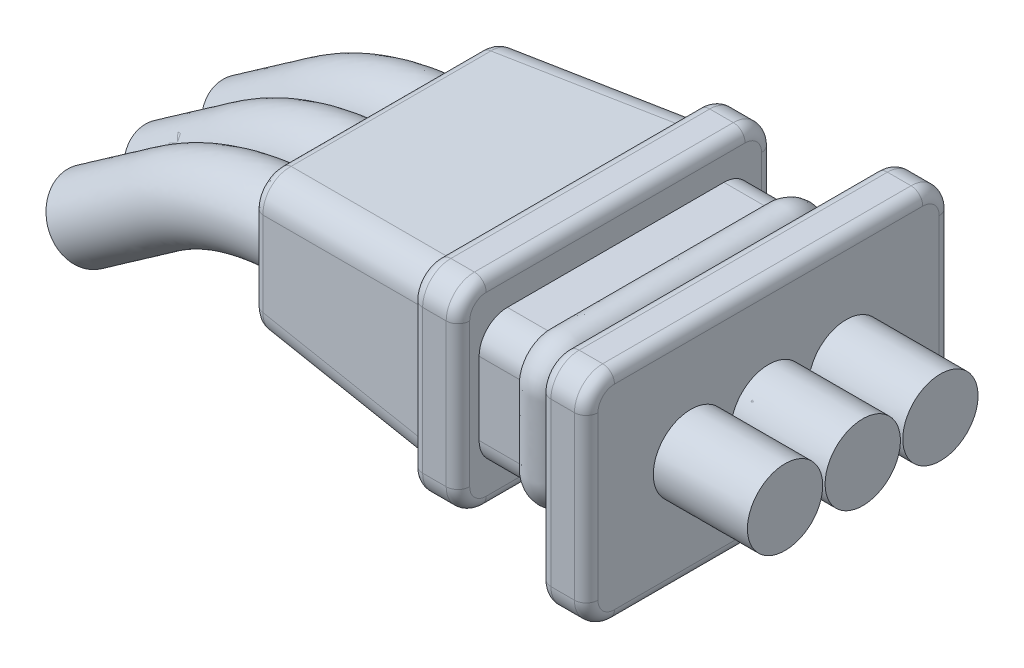
from build123d import *

# Parameters (mm, degrees)
SKETCH1_W            = 7.75
SKETCH1_H            = 4.65
BOSS_EXTRUDE1_DEPTH  = 1
SKETCH2_W            = 5.8
SKETCH2_H            = 2.75
BOSS_EXTRUDE2_DEPTH  = 2.25
SKETCH3_W            = 6.7
SKETCH3_H            = 4.25
BOSS_EXTRUDE3_DEPTH  = 1
SKETCH4_W            = 6.1
SKETCH4_H            = 3.65
BOSS_EXTRUDE4_DEPTH  = 4
BOSS_EXTRUDE4_TAPER  = 5
FILLET1_R            = 0.6
FILLET2_R            = 0.25
CUT_EXTRUDE6_DEPTH   = 10.406580185
SWEEP3_PROFILE_R     = 0.8
LPATTERN1_COUNT      = 2
LPATTERN1_PITCH      = 1.65
LPATTERN1_COUNT_DIR2 = 2
LPATTERN1_PITCH_DIR2 = 1.65


with BuildPart() as part:
    # Sketch1 → Boss-Extrude1 (new body)
    with BuildSketch(Plane(origin=(0, 0, 0), x_dir=(0, 0, -1), z_dir=(1, 0, 0))):
        Rectangle(SKETCH1_W, SKETCH1_H)
    extrude(amount=BOSS_EXTRUDE1_DEPTH)

    # Sketch2 → Boss-Extrude2 (add)
    with BuildSketch(Plane.ZY):
        Rectangle(SKETCH2_W, SKETCH2_H)
    extrude(amount=BOSS_EXTRUDE2_DEPTH)

    # Sketch3 → Boss-Extrude3 (add)
    with BuildSketch(Plane.ZY.offset(2.25)):
        Rectangle(SKETCH3_W, SKETCH3_H)
    extrude(amount=BOSS_EXTRUDE3_DEPTH)

    # Sketch4 → Boss-Extrude4 (add)
    with BuildSketch(Plane.ZY.offset(3.25)):
        Rectangle(SKETCH4_W, SKETCH4_H)
    extrude(amount=BOSS_EXTRUDE4_DEPTH, taper=BOSS_EXTRUDE4_TAPER)

    # Fillet1
    fillet1_edges = [part.edges().sort_by_distance(p)[0] for p in [
        (-1.125, -1.375, -2.9),
        (-1.125, 1.375, -2.9),
        (-1.125, -1.375, 2.9),
        (0.5, 2.325, -3.875),
        (0.5, -2.325, -3.875),
        (0.5, -2.325, 3.875),
        (-2.75, 2.125, -3.35),
        (-2.75, -2.125, -3.35),
        (-5.25, -1.650022673, -2.875022673),
        (-5.25, -1.650022673, 2.875022673),
        (-5.25, 1.650022673, -2.875022673),
        (-2.75, -2.125, 3.35),
        (0.5, 2.325, 3.875),
        (-1.125, 1.375, 2.9),
        (-5.25, 1.650022673, 2.875022673),
        (-2.75, 2.125, 3.35),
    ]]
    fillet(fillet1_edges, radius=FILLET1_R)

    # Sweep2: sweep along a path in Sketch7
    with BuildLine(Plane.ZY) as sweep2_path:
        Line((-2.3, -1.375), (2.3, -1.375))
        ThreePointArc((2.3, -1.375), (2.724264069, -1.199264069), (2.9, -0.775))
        Line((2.9, -0.775), (2.9, 0.775))
        ThreePointArc((2.9, 0.775), (2.724264069, 1.199264069), (2.3, 1.375))
        Line((2.3, 1.375), (-2.3, 1.375))
        ThreePointArc((-2.3, 1.375), (-2.724264069, 1.199264069), (-2.9, 0.775))
        Line((-2.9, 0.775), (-2.9, -0.775))
        ThreePointArc((-2.9, -0.775), (-2.724264069, -1.199264069), (-2.3, -1.375))
    # Sketch5 → Sweep2 (sweep)
    with BuildSketch(Plane(origin=(0, 0, 0), x_dir=(1, 0, 0), z_dir=(0, 1, 0))):
        with BuildLine():
            Line((-0.625, 2.9), (-1.375, 2.9))
            ThreePointArc((-1.375, 2.9), (-1, 3.116506351), (-0.625, 2.9))
        make_face()
    sweep(path=sweep2_path.line)

    # Fillet2
    fillet2_edges = [part.edges().sort_by_distance(p)[0] for p in [
        (1, -2.149264069, 3.699264069),
        (1, 0, 3.875),
        (1, 2.149264069, 3.699264069),
        (1, 2.325, 0),
        (1, 2.149264069, -3.699264069),
        (1, 0, -3.875),
        (1, -2.149264069, -3.699264069),
        (0, -2.149264069, 3.699264069),
        (0, 0, 3.875),
        (0, 2.149264069, 3.699264069),
        (0, 2.325, 0),
        (0, 2.149264069, -3.699264069),
        (0, 0, -3.875),
        (0, -2.149264069, -3.699264069),
        (1, -2.325, 0),
        (0, -2.325, 0),
        (-7.25, -1.300252666, -2.52525255),
        (-7.25, 0, -2.700045346),
        (-7.25, 1.30025255, -2.525252666),
        (-7.25, 1.475045346, 0),
        (-7.25, 1.300252666, 2.52525255),
        (-7.25, 0, 2.700045346),
        (-7.25, -1.300252666, 2.52525255),
        (-3.25, -1.949264069, -3.174264069),
        (-3.25, 0, -3.35),
        (-3.25, 1.949264069, -3.174264069),
        (-3.25, 2.125, 0),
        (-3.25, 1.949264069, 3.174264069),
        (-3.25, 0, 3.35),
        (-3.25, -1.949264069, 3.174264069),
        (-2.25, -1.949264069, -3.174264069),
        (-2.25, 0, -3.35),
        (-2.25, 1.949264069, -3.174264069),
        (-2.25, 2.125, 0),
        (-2.25, 1.949264069, 3.174264069),
        (-2.25, 0, 3.35),
        (-2.25, -1.949264069, 3.174264069),
        (-7.25, -1.475045346, 0),
        (-3.25, -2.125, 0),
        (-2.25, -2.125, 0),
    ]]
    fillet(fillet2_edges, radius=FILLET2_R)

    # Sketch15 → Cut-Extrude6 (cut, through all)
    with BuildSketch(Plane.ZY.offset(7.25)):
        with BuildLine():
            Line((-0.854701314, 0.25), (-0.795298686, 0.25))
            ThreePointArc((-0.795298686, 0.25), (-0.766858863, 0.258876084), (-0.74851641, 0.282352941))
            ThreePointArc((-0.74851641, 0.282352941), (0, 0.8), (0.74851641, 0.282352941))
            ThreePointArc((0.74851641, 0.282352941), (0.766858863, 0.258876084), (0.795298686, 0.25))
            Line((0.795298686, 0.25), (0.854701314, 0.25))
            ThreePointArc((0.854701314, 0.25), (0.883141137, 0.258876084), (0.90148359, 0.282352941))
            ThreePointArc((0.90148359, 0.282352941), (2.45, 0), (0.90148359, -0.282352941))
            ThreePointArc((0.90148359, -0.282352941), (0.883141137, -0.258876084), (0.854701314, -0.25))
            Line((0.854701314, -0.25), (0.795298686, -0.25))
            ThreePointArc((0.795298686, -0.25), (0.766858863, -0.258876084), (0.74851641, -0.282352941))
            ThreePointArc((0.74851641, -0.282352941), (0, -0.8), (-0.74851641, -0.282352941))
            ThreePointArc((-0.74851641, -0.282352941), (-0.766858863, -0.258876084), (-0.795298686, -0.25))
            Line((-0.795298686, -0.25), (-0.854701314, -0.25))
            ThreePointArc((-0.854701314, -0.25), (-0.883141137, -0.258876084), (-0.90148359, -0.282352941))
            ThreePointArc((-0.90148359, -0.282352941), (-2.45, 0), (-0.90148359, 0.282352941))
            ThreePointArc((-0.90148359, 0.282352941), (-0.883141137, 0.258876084), (-0.854701314, 0.25))
        make_face()
    extrude(amount=-CUT_EXTRUDE6_DEPTH, mode=Mode.SUBTRACT)


with BuildPart() as body_2:
    # Sweep3: sweep along a path in Sketch10
    with BuildLine(Plane.XY) as sweep3_path:
        Line((-11.779692326, -2.051392651), (-10.141388237, -0.904239779))
        ThreePointArc((-10.141388237, -0.904239779), (-8.777035053, -0.231415246), (-7.273506056, 0))
        Line((-7.273506056, 0), (1, 0))
        Line((1, 0), (3, 0))
    # Sweep3 profile (on start of the path) → Sweep3 (sweep)
    with BuildSketch(Plane(origin=(-11.779692326, -2.051392651, 0), x_dir=(-0.5735764363510475, 0.8191520442889908, 0), z_dir=(0.8191520442889908, 0.5735764363510475, 0))):
        Circle(SWEEP3_PROFILE_R)
    sweep3 = sweep(path=sweep3_path.line)


with BuildPart() as lpattern1_1:
    # LPattern1: Sweep3 2 × 2
    with Locations(*[Vector(0, 0, -1) * (i * LPATTERN1_PITCH) + Vector(0, 0, 1) * (j * LPATTERN1_PITCH_DIR2) for i in range(LPATTERN1_COUNT) for j in range(LPATTERN1_COUNT_DIR2) if (i, j) != (0, 0)]):
        add(sweep3)


solid = Compound([part.part, body_2.part, lpattern1_1.part])
